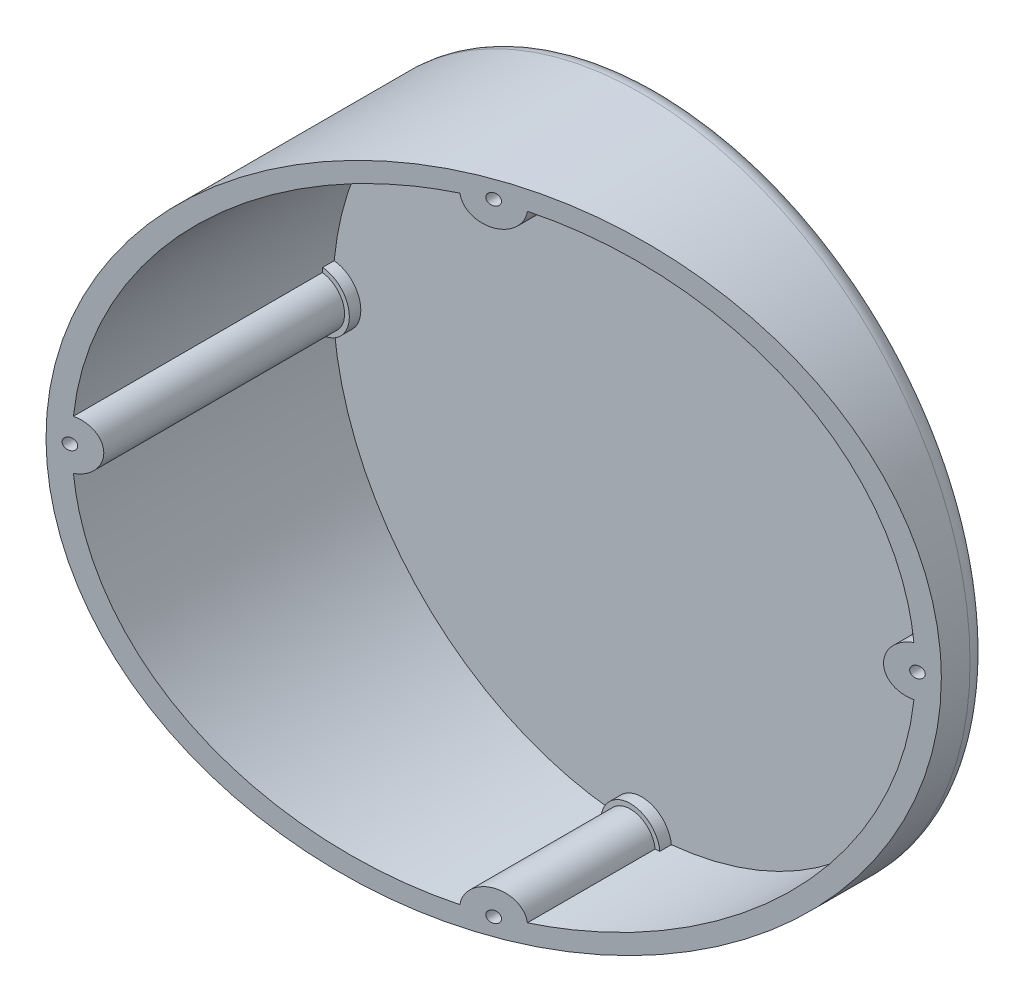
from build123d import *

# Parameters (mm, degrees)
SKETCH_1_R                = 51.5
EXTRUDE_1_DEPTH           = 45
CUT_EXTRUDE_1_DEPTH       = 86.612499087
CUT_EXTRUDE_1_DEPTH_BACK  = 86.612499087
FILLET_1_R                = 3
HOLE_WIZARD_1_D           = 1.8
HOLE_WIZARD_1_CBORE_D     = 3.3
HOLE_WIZARD_1_CBORE_DEPTH = 1.8
PATTERN_CIRCULAR_1_COUNT  = 4
SHELL_START               = 3
SHELL_5_DEPTH             = 40.851543255
SHELL_START_2             = 4.8
SHELL_5_2_DEPTH           = 39.051543255


# Read off the part's stored shape, not the designer's step: 抽壳5
with BuildPart() as part:
    # 草图1 → 凸台-拉伸1 (new body)
    with BuildSketch(Plane.XY):
        with Locations(Location((0, 0, 0), (0, 0, 180))):
            Circle(SKETCH_1_R)
    extrude(amount=EXTRUDE_1_DEPTH)

    # 草图2 → 切除-拉伸1 (cut, two sides: drawn at the far end of the back side and taken through both)
    with BuildSketch(Plane(origin=(0, 0, 0), x_dir=(1, 0, 0), z_dir=(0, 1, 0)).offset(-CUT_EXTRUDE_1_DEPTH_BACK)):
        Polygon((-51.5, -45), (51.5, -45), (51.5, -7.511065871), align=None)
    extrude(amount=CUT_EXTRUDE_1_DEPTH + CUT_EXTRUDE_1_DEPTH_BACK, mode=Mode.SUBTRACT)

    # 圆角1
    fillet_1_edges = [part.edges().sort_by_distance(p)[0] for p in [
        (51.5, 0, 0),
    ]]
    fillet(fillet_1_edges, radius=FILLET_1_R)

    # 打孔尺寸(%根据)内六角圆柱头螺钉的类型1 (through all)
    with Locations(Plane(origin=(0, 0, 0), x_dir=(-1, 0, 0), z_dir=(0, 0, -1))):
        with Locations((0, 48.75)):
            hole_wizard_1 = CounterBoreHole(HOLE_WIZARD_1_D / 2, HOLE_WIZARD_1_CBORE_D / 2, HOLE_WIZARD_1_CBORE_DEPTH)

    # 阵列(圆周)1: 打孔尺寸(%根据)内六角圆柱头螺钉的类型1 ×4 about axis
    pattern_circular_1_axis = Axis((0, 0, 0), (0, 0, 1))
    for i in range(1, PATTERN_CIRCULAR_1_COUNT):
        add(hole_wizard_1.rotate(pattern_circular_1_axis, i * 360 / PATTERN_CIRCULAR_1_COUNT), mode=Mode.SUBTRACT)

    # 抽壳5 outline → 抽壳5 (cut)
    with BuildSketch(Plane.XY.offset(SHELL_START)):
        with BuildLine():
            ThreePointArc((-48.278871795, -4.626071575), (-34.294678888, -34.294678888), (-4.626071575, -48.278871795))
            ThreePointArc((-4.626071575, -48.278871795), (0, -44.1), (4.626071575, -48.278871795))
            ThreePointArc((4.626071575, -48.278871795), (34.294678888, -34.294678888), (48.278871795, -4.626071575))
            ThreePointArc((48.278871795, -4.626071575), (44.1, 0), (48.278871795, 4.626071575))
            ThreePointArc((48.278871795, 4.626071575), (34.294678888, 34.294678888), (4.626071575, 48.278871795))
            ThreePointArc((4.626071575, 48.278871795), (0, 44.1), (-4.626071575, 48.278871795))
            ThreePointArc((-4.626071575, 48.278871795), (-34.294678888, 34.294678888), (-48.278871795, 4.626071575))
            ThreePointArc((-48.278871795, 4.626071575), (-44.1, 0), (-48.278871795, -4.626071575))
        make_face()
    extrude(amount=SHELL_5_DEPTH, mode=Mode.SUBTRACT)

    # Shell 5 2 outline → Shell 5 2 (cut)
    with BuildSketch(Plane.XY.offset(SHELL_START_2)):
        with BuildLine():
            ThreePointArc((4.626071575, -48.278871795), (0, -44.1), (-4.626071575, -48.278871795))
            ThreePointArc((-4.626071575, -48.278871795), (-4.252601262, -48.313200914), (-3.878876655, -48.344641026))
            ThreePointArc((-3.878876655, -48.344641026), (0, -44.85), (3.878876655, -48.344641026))
            ThreePointArc((3.878876655, -48.344641026), (4.252601262, -48.313200914), (4.626071575, -48.278871795))
        make_face()
        with BuildLine():
            ThreePointArc((-48.344641026, -3.878876655), (-48.313200914, -4.252601262), (-48.278871795, -4.626071575))
            ThreePointArc((-48.278871795, -4.626071575), (-44.1, 0), (-48.278871795, 4.626071575))
            ThreePointArc((-48.278871795, 4.626071575), (-48.313200914, 4.252601262), (-48.344641026, 3.878876655))
            ThreePointArc((-48.344641026, 3.878876655), (-44.85, 0), (-48.344641026, -3.878876655))
        make_face()
        with BuildLine():
            ThreePointArc((48.278871795, 4.626071575), (44.1, 0), (48.278871795, -4.626071575))
            ThreePointArc((48.278871795, -4.626071575), (48.313200914, -4.252601262), (48.344641026, -3.878876655))
            ThreePointArc((48.344641026, -3.878876655), (44.85, 0), (48.344641026, 3.878876655))
            ThreePointArc((48.344641026, 3.878876655), (48.313200914, 4.252601262), (48.278871795, 4.626071575))
        make_face()
        with BuildLine():
            ThreePointArc((-3.878876655, 48.344641026), (-4.252601262, 48.313200914), (-4.626071575, 48.278871795))
            ThreePointArc((-4.626071575, 48.278871795), (0, 44.1), (4.626071575, 48.278871795))
            ThreePointArc((4.626071575, 48.278871795), (4.252601262, 48.313200914), (3.878876655, 48.344641026))
            ThreePointArc((3.878876655, 48.344641026), (0, 44.85), (-3.878876655, 48.344641026))
        make_face()
    extrude(amount=SHELL_5_2_DEPTH, mode=Mode.SUBTRACT)


solid = part.part
